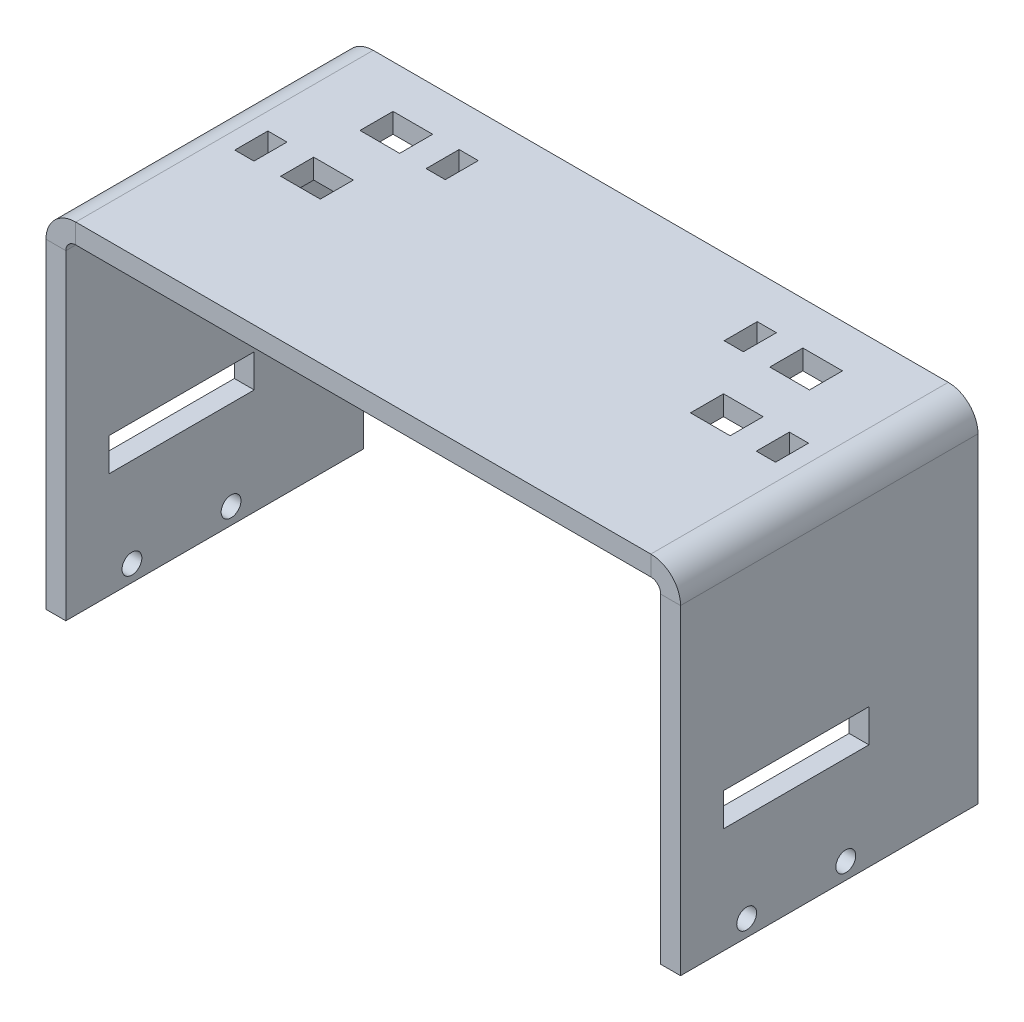
from build123d import *

# Parameters (mm, degrees)
SKETCH1_R                  = 1.5
SKETCH1_W                  = 2.9
SKETCH1_H                  = 5
SKETCH1_W_2                = 6
SKETCH1_W_3                = 5
SKETCH1_H_2                = 22
BASE_FLANGE1_DEPTH         = 3
SKETCHED_START             = -31.946571622
SKETCHED_BEND1_DEPTH       = 45
SKETCHED_BEND1_2_OUTLINE_W = 3
SKETCHED_BEND1_2_OUTLINE_H = 16
SKETCHED_BEND1_2_DEPTH     = 45
SKETCHED_BEND1_3_OUTLINE_W = 3
SKETCHED_BEND1_3_OUTLINE_H = 5
SKETCHED_BEND1_3_DEPTH     = 16.5
SKETCHED_START_2           = 6.553428378
SKETCHED_BEND1_4_OUTLINE_W = 3
SKETCHED_BEND1_4_OUTLINE_H = 5
SKETCHED_BEND1_4_DEPTH     = 6.5
SKETCHED_START_3           = -49
SKETCHED_BEND1_5_OUTLINE_R = 1.5
SKETCHED_BEND1_5_DEPTH     = 98


with BuildPart() as part:
    # Base-Flange1: sheet metal written as solids
    # Sketch1 → Base-Flange1 (new body)
    with BuildSketch(Plane(origin=(0, 0, 0), x_dir=(1, 0, 0), z_dir=(0, 1, 0))):
        Polygon((-95, 31.946571622), (-95, -13.053428378), (95, -13.053428378), (95, 31.946571622), (45, 31.946571622), (-45, 31.946571622), align=None)
        with Locations(Location((92.5, -3.053428378, 0), (0, 0, 270))):
            Circle(SKETCH1_R, mode=Mode.SUBTRACT)
        with Locations(Location((92.5, 11.946571622, 0), (0, 0, 270))):
            Circle(SKETCH1_R, mode=Mode.SUBTRACT)
        with Locations(Location((-92.5, -3.053428378, 0), (0, 0, 90))):
            Circle(SKETCH1_R, mode=Mode.SUBTRACT)
        with Locations(Location((-92.5, 11.946571622, 0), (0, 0, 90))):
            Circle(SKETCH1_R, mode=Mode.SUBTRACT)
        with Locations((-39.45, 10.905641405)):
            Rectangle(SKETCH1_W, SKETCH1_H, mode=Mode.SUBTRACT)
        with Locations((-22.55, 22.947848405)):
            Rectangle(SKETCH1_W, SKETCH1_H, mode=Mode.SUBTRACT)
        with Locations((-31, 22.946571622)):
            Rectangle(SKETCH1_W_2, SKETCH1_H, mode=Mode.SUBTRACT)
        with Locations((-31, 10.946571622)):
            Rectangle(SKETCH1_W_2, SKETCH1_H, mode=Mode.SUBTRACT)
        with Locations((31, 10.946571622)):
            Rectangle(SKETCH1_W_2, SKETCH1_H, mode=Mode.SUBTRACT)
        with Locations((31, 22.946571622)):
            Rectangle(SKETCH1_W_2, SKETCH1_H, mode=Mode.SUBTRACT)
        with Locations((22.55, 22.947848405)):
            Rectangle(SKETCH1_W, SKETCH1_H, mode=Mode.SUBTRACT)
        with Locations((39.45, 10.905641405)):
            Rectangle(SKETCH1_W, SKETCH1_H, mode=Mode.SUBTRACT)
        with Locations((76.5, 4.446571622)):
            Rectangle(SKETCH1_W_3, SKETCH1_H_2, mode=Mode.SUBTRACT)
        with Locations((-76.5, 4.446571622)):
            Rectangle(SKETCH1_W_3, SKETCH1_H_2, mode=Mode.SUBTRACT)
    extrude(amount=-BASE_FLANGE1_DEPTH)

    # Sketched Bend1: read off the stored shape, not the designer's step
    # Sketched Bend1 outline → Sketched Bend1 (cut)
    with BuildSketch(Plane.XY.offset(SKETCHED_START)):
        with BuildLine():
            ThreePointArc((43.5, 0), (46.098076211, -0.825765386), (47.742640687, -3))
            Line((47.742640687, -3), (95, -3))
            Line((95, -3), (95, 0))
            Line((95, 0), (43.5, 0))
        make_face()
        with BuildLine():
            ThreePointArc((-47.742640687, -3), (-46.098076211, -0.825765386), (-43.5, 0))
            Line((-43.5, 0), (-95, 0))
            Line((-95, 0), (-95, -3))
            Line((-95, -3), (-47.742640687, -3))
        make_face()
    extrude(amount=SKETCHED_BEND1_DEPTH, mode=Mode.SUBTRACT)

    # Sketched Bend1 2 outline → Sketched Bend1 2 (add)
    with BuildSketch(Plane.XY.offset(SKETCHED_START)):
        with BuildLine():
            ThreePointArc((43.5, -3), (44.560660172, -3.439339828), (45, -4.5))
            Line((45, -4.5), (45, -32))
            Line((45, -32), (48, -32))
            Line((48, -32), (48, -4.5))
            ThreePointArc((48, -4.5), (47.935193518, -3.739041096), (47.742640687, -3))
            Line((47.742640687, -3), (43.5, -3))
        make_face()
        with BuildLine():
            ThreePointArc((-45, -4.5), (-44.560660172, -3.439339828), (-43.5, -3))
            Line((-43.5, -3), (-47.742640687, -3))
            ThreePointArc((-47.742640687, -3), (-47.935193518, -3.739041096), (-48, -4.5))
            Line((-48, -4.5), (-48, -32))
            Line((-48, -32), (-45, -32))
            Line((-45, -32), (-45, -4.5))
        make_face()
        with Locations((46.5, -45)):
            Rectangle(SKETCHED_BEND1_2_OUTLINE_W, SKETCHED_BEND1_2_OUTLINE_H)
        with Locations((-46.5, -45)):
            Rectangle(SKETCHED_BEND1_2_OUTLINE_W, SKETCHED_BEND1_2_OUTLINE_H)
    extrude(amount=SKETCHED_BEND1_2_DEPTH)

    # Sketched Bend1 3 outline → Sketched Bend1 3 (add)
    with BuildSketch(Plane.XY.offset(SKETCHED_START)):
        with Locations((46.5, -34.5)):
            Rectangle(SKETCHED_BEND1_3_OUTLINE_W, SKETCHED_BEND1_3_OUTLINE_H)
        with Locations((-46.5, -34.5)):
            Rectangle(SKETCHED_BEND1_3_OUTLINE_W, SKETCHED_BEND1_3_OUTLINE_H)
    extrude(amount=SKETCHED_BEND1_3_DEPTH)

    # Sketched Bend1 4 outline → Sketched Bend1 4 (add)
    with BuildSketch(Plane.XY.offset(SKETCHED_START_2)):
        with Locations((46.5, -34.5)):
            Rectangle(SKETCHED_BEND1_4_OUTLINE_W, SKETCHED_BEND1_4_OUTLINE_H)
        with Locations((-46.5, -34.5)):
            Rectangle(SKETCHED_BEND1_4_OUTLINE_W, SKETCHED_BEND1_4_OUTLINE_H)
    extrude(amount=SKETCHED_BEND1_4_DEPTH)

    # Sketched Bend1 5 outline → Sketched Bend1 5 (cut)
    with BuildSketch(Plane.YZ.offset(SKETCHED_START_3)):
        with Locations((-50.5, -11.946571622)):
            Circle(SKETCHED_BEND1_5_OUTLINE_R)
        with Locations((-50.5, 3.053428378)):
            Circle(SKETCHED_BEND1_5_OUTLINE_R)
    extrude(amount=SKETCHED_BEND1_5_DEPTH, mode=Mode.SUBTRACT)


solid = part.part
